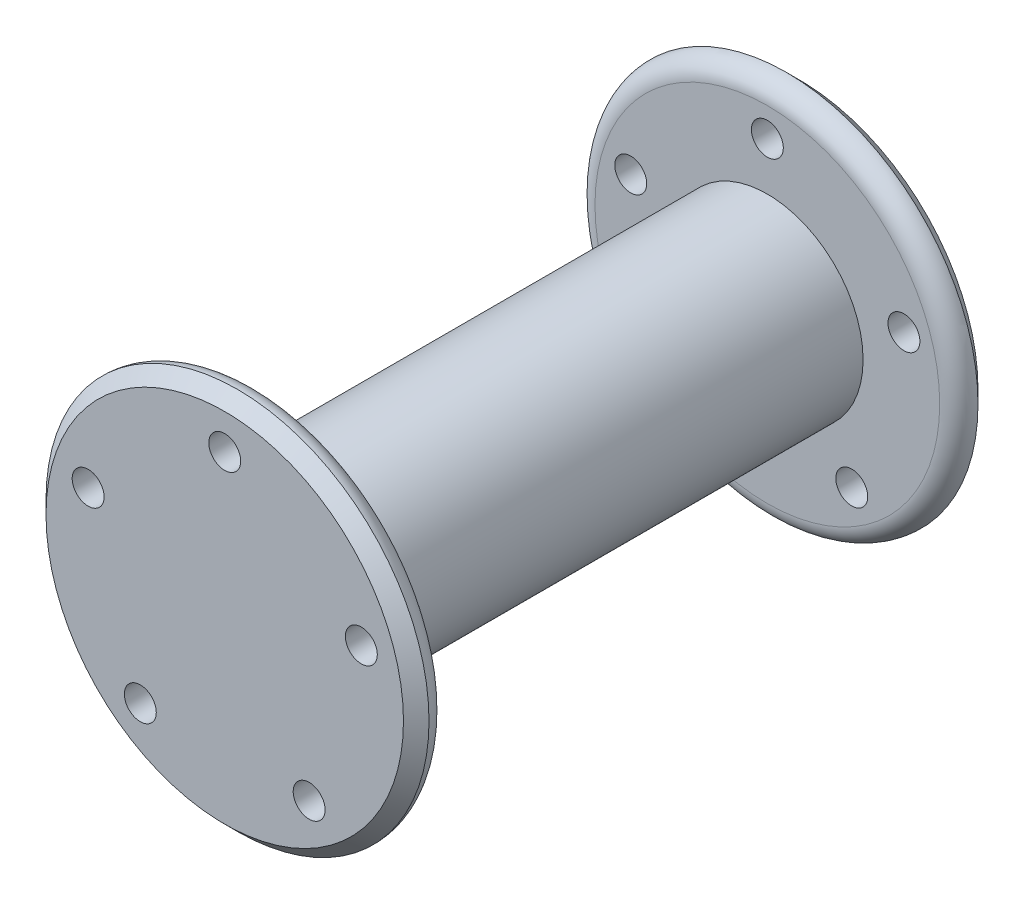
from build123d import *

# Parameters (mm, degrees)
SKETCH1_R                = 15
BOSS_EXTRUDE1_DEPTH      = 40
SKETCH2_R                = 30
BOSS_EXTRUDE2_DEPTH      = 5
CHAMFER1_SIZE            = 2
SKETCH5_R                = 2.5
CUT_EXTRUDE1_DEPTH       = 96
CIRPATTERN1_COUNT        = 5
FILLET1_R                = 3
MIRROR2_COPY_1_SKETCH_R  = 2.5
MIRROR2_COPY_1_DEPTH     = 96
MIRROR2_COPY_2_SKETCH_R  = 2.5
MIRROR2_COPY_2_DEPTH     = 96
MIRROR2_COPY_3_SKETCH_R  = 2.5
MIRROR2_COPY_3_DEPTH     = 96
MIRROR2_COPY_4_SKETCH_R  = 2.5
MIRROR2_COPY_4_DEPTH     = 96
CHAMFER1_OF_MIRROR2_SIZE = 2
FILLET1_OF_MIRROR2_R     = 3


with BuildPart() as part:
    # Sketch1 → Boss-Extrude1 (new, symmetric)
    with BuildSketch(Plane.XY):
        Circle(SKETCH1_R)
    extrude(amount=BOSS_EXTRUDE1_DEPTH, both=True)

    # Sketch2 → Boss-Extrude2 (add)
    with BuildSketch(Plane(origin=(0, 0, -40), x_dir=(-1, 0, 0), z_dir=(0, 0, -1))):
        Circle(SKETCH2_R)
    boss_extrude2 = extrude(amount=BOSS_EXTRUDE2_DEPTH)

    # Chamfer1
    chamfer1_edges = [part.edges().sort_by_distance(p)[0] for p in [
        (30, 0, -45),
    ]]
    chamfer(chamfer1_edges, length=CHAMFER1_SIZE)

    # Sketch5 → Cut-Extrude1 (cut, through all)
    with BuildSketch(Plane(origin=(0, 0, -45), x_dir=(-1, 0, 0), z_dir=(0, 0, -1))):
        with Locations((0, 22.5)):
            Circle(SKETCH5_R)
    cut_extrude1 = extrude(amount=-CUT_EXTRUDE1_DEPTH, mode=Mode.SUBTRACT)

    # CirPattern1: Cut-Extrude1 ×5 about axis
    cirpattern1_axis = Axis((0, 0, 0), (0, 0, 1))
    for i in range(1, CIRPATTERN1_COUNT):
        add(cut_extrude1.rotate(cirpattern1_axis, i * 360 / CIRPATTERN1_COUNT), mode=Mode.SUBTRACT)

    # Fillet1
    fillet1_edges = [part.edges().sort_by_distance(p)[0] for p in [
        (30, 0, -40),
    ]]
    fillet(fillet1_edges, radius=FILLET1_R - 0.0001)  # a hair under: the kernel refuses the full size

    # Mirror2: Boss-Extrude2, Cut-Extrude1 across plane
    add(boss_extrude2.mirror(Plane.XY))
    add(cut_extrude1.mirror(Plane.XY), mode=Mode.SUBTRACT)

    # Mirror2 copy 1 sketch → Mirror2 copy 1 (cut, through all)
    with BuildSketch(Plane(origin=(0, 0, 45), x_dir=(-0.30901699437494745, -0.9510565162951535, 0), z_dir=(0, 0, 1))):
        with Locations((0, -22.5)):
            Circle(MIRROR2_COPY_1_SKETCH_R)
    extrude(amount=-MIRROR2_COPY_1_DEPTH, mode=Mode.SUBTRACT)

    # Mirror2 copy 2 sketch → Mirror2 copy 2 (cut, through all)
    with BuildSketch(Plane(origin=(0, 0, 45), x_dir=(0.8090169943749473, -0.5877852522924732, 0), z_dir=(0, 0, 1))):
        with Locations((0, -22.5)):
            Circle(MIRROR2_COPY_2_SKETCH_R)
    extrude(amount=-MIRROR2_COPY_2_DEPTH, mode=Mode.SUBTRACT)

    # Mirror2 copy 3 sketch → Mirror2 copy 3 (cut, through all)
    with BuildSketch(Plane(origin=(0, 0, 45), x_dir=(0.8090169943749476, 0.587785252292473, 0), z_dir=(0, 0, 1))):
        with Locations((0, -22.5)):
            Circle(MIRROR2_COPY_3_SKETCH_R)
    extrude(amount=-MIRROR2_COPY_3_DEPTH, mode=Mode.SUBTRACT)

    # Mirror2 copy 4 sketch → Mirror2 copy 4 (cut, through all)
    with BuildSketch(Plane(origin=(0, 0, 45), x_dir=(-0.30901699437494723, 0.9510565162951536, 0), z_dir=(0, 0, 1))):
        with Locations((0, -22.5)):
            Circle(MIRROR2_COPY_4_SKETCH_R)
    extrude(amount=-MIRROR2_COPY_4_DEPTH, mode=Mode.SUBTRACT)

    # Chamfer1 of Mirror2
    chamfer1_of_mirror2_edges = [part.edges().sort_by_distance(p)[0] for p in [
        (30, 0, 45),
    ]]
    chamfer(chamfer1_of_mirror2_edges, length=CHAMFER1_OF_MIRROR2_SIZE)

    # Fillet1 of Mirror2
    fillet1_of_mirror2_edges = [part.edges().sort_by_distance(p)[0] for p in [
        (30, 0, 40),
    ]]
    fillet(fillet1_of_mirror2_edges, radius=FILLET1_OF_MIRROR2_R - 0.0001)  # a hair under: the kernel refuses the full size


solid = part.part
